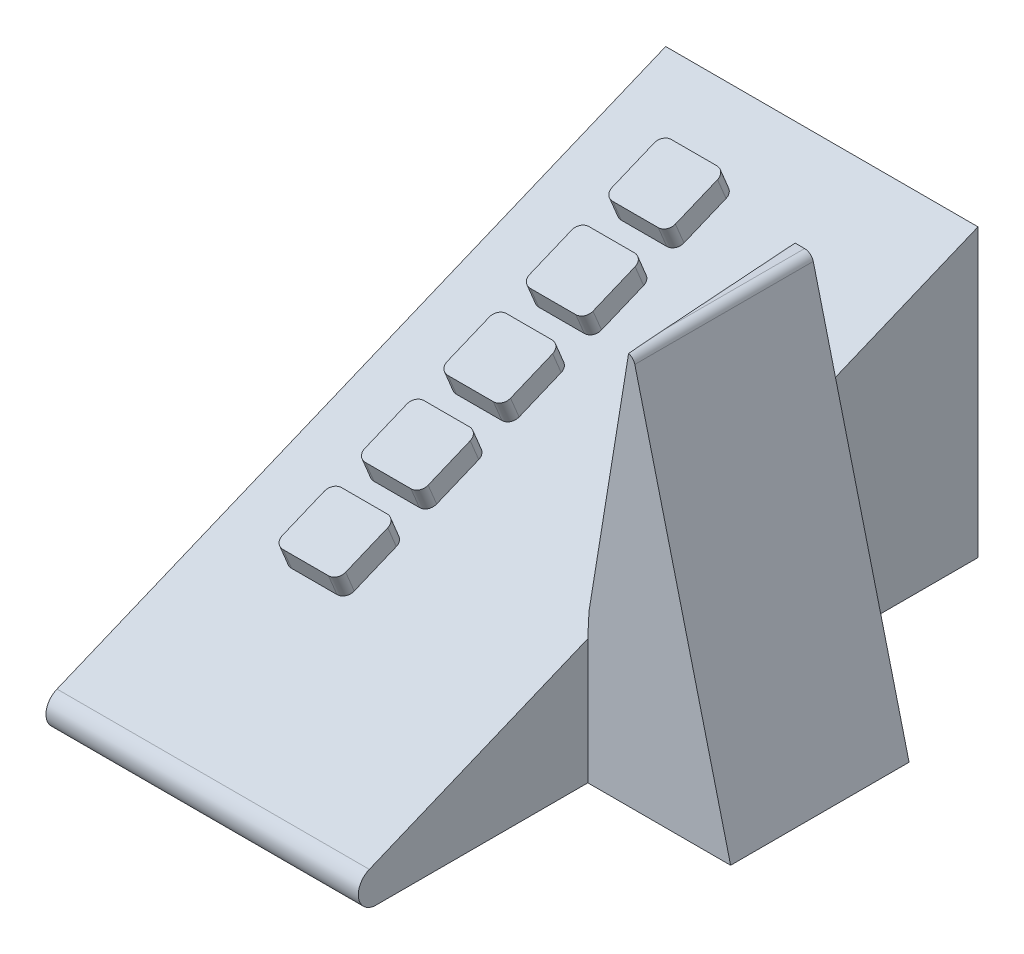
from build123d import *

# Parameters (mm, degrees)
BOSS_EXTRUDE1_DEPTH = 88.9
SKETCH3_W           = 18.049999968
SKETCH3_H           = 18.049999968
BOSS_EXTRUDE2_DEPTH = 6.35
FILLET1_R           = 2.54
FILLET2_R           = 5.08
BOSS_EXTRUDE3_DEPTH = 40.64
CAVITY1_START       = 93.019234599
CAVITY1_DEPTH       = 75.946275307
CUT_EXTRUDE1_DEPTH  = 181.905623168
FILLET3_R           = 2.54


# Read off the part's stored shape, not the designer's step: Cavity1
with BuildPart() as part:
    # Sketch2 → Boss-Extrude1 (new body)
    with BuildSketch(Plane(origin=(0, 0, 0), x_dir=(0, 0, -1), z_dir=(1, 0, 0))):
        Polygon((0, 0), (196.85, 81.537939753), (196.85, 0), align=None)
    extrude(amount=-BOSS_EXTRUDE1_DEPTH)

    # Sketch3 → Boss-Extrude2 (add)
    with BuildSketch(Plane(origin=(0, 0, 0), x_dir=(1, 0, 0), z_dir=(0, 0.9238795325112891, 0.3826834323650843))):
        with Locations((-60.317000016, 184.485904644)):
            Rectangle(SKETCH3_W, SKETCH3_H)
        with Locations((-60.317000016, 159.085904644)):
            Rectangle(SKETCH3_W, SKETCH3_H)
        with Locations((-60.317000016, 133.685904644)):
            Rectangle(SKETCH3_W, SKETCH3_H)
        with Locations((-60.317000016, 108.285904644)):
            Rectangle(SKETCH3_W, SKETCH3_H)
        with Locations((-60.317000016, 82.885904644)):
            Rectangle(SKETCH3_W, SKETCH3_H)
    extrude(amount=BOSS_EXTRUDE2_DEPTH)

    # Fillet1
    fillet1_edges = [part.edges().sort_by_distance(p)[0] for p in [
        (-69.342, 76.986734699, -177.565744205),
        (-69.342, 70.079298757, -160.889718673),
        (-51.292000032, 70.079298757, -160.889718673),
        (-51.292000032, 76.986734699, -177.565744205),
        (-51.292000032, 67.266575517, -154.09920408),
        (-69.342, 67.266575517, -154.09920408),
        (-69.342, 60.359139575, -137.423178547),
        (-51.292000032, 60.359139575, -137.423178547),
        (-51.292000032, 57.546416335, -130.632663954),
        (-69.342, 57.546416335, -130.632663954),
        (-69.342, 50.638980393, -113.956638422),
        (-51.292000032, 50.638980393, -113.956638422),
        (-51.292000032, 47.826257152, -107.166123828),
        (-69.342, 47.826257152, -107.166123828),
        (-69.342, 40.918821211, -90.490098296),
        (-51.292000032, 40.918821211, -90.490098296),
        (-51.292000032, 38.10609797, -83.699583702),
        (-69.342, 38.10609797, -83.699583702),
        (-69.342, 31.198662028, -67.02355817),
        (-51.292000032, 31.198662028, -67.02355817),
    ]]
    fillet(fillet1_edges, radius=FILLET1_R)

    # Fillet2
    fillet2_edges = [part.edges().sort_by_distance(p)[0] for p in [
        (-44.45, 0, 0),
    ]]
    fillet(fillet2_edges, radius=FILLET2_R)

    # Sketch4 → Boss-Extrude3 (add)
    with BuildSketch(Plane(origin=(0, 0, 0), x_dir=(0, 0, -1), z_dir=(1, 0, 0))):
        Polygon((111.19444231, 0), (85.79444231, 0), (85.79444231, 111.76), (136.59444231, 111.76), (136.59444231, 0), align=None)
    extrude(amount=BOSS_EXTRUDE3_DEPTH)

    # Cavity1 outline → Cavity1 (cut)
    with BuildSketch(Plane(origin=(0, 0, 0), x_dir=(1, 0, 0), z_dir=(0, 0.38268343236508323, -0.9238795325112895)).offset(CAVITY1_START)):
        Polygon((0.339752359, -6.447958985), (0, -0.376615902), (0, -72), (11.89834583, -72), (11.619866439, -70.420664892), align=None)
    extrude(amount=CAVITY1_DEPTH, mode=Mode.SUBTRACT)

    # Sketch8 → Cut-Extrude1 (cut, through all)
    with BuildSketch(Plane.XY.offset(-85.79444231)):
        Polygon((12.889866439, 111.76), (40.64, 0), (40.64, 111.76), align=None)
    extrude(amount=-CUT_EXTRUDE1_DEPTH, mode=Mode.SUBTRACT)

    # Fillet3
    fillet3_edges = [part.edges().sort_by_distance(p)[0] for p in [
        (12.889866439, 111.76, -111.19444231),
    ]]
    fillet(fillet3_edges, radius=FILLET3_R)


solid = part.part
